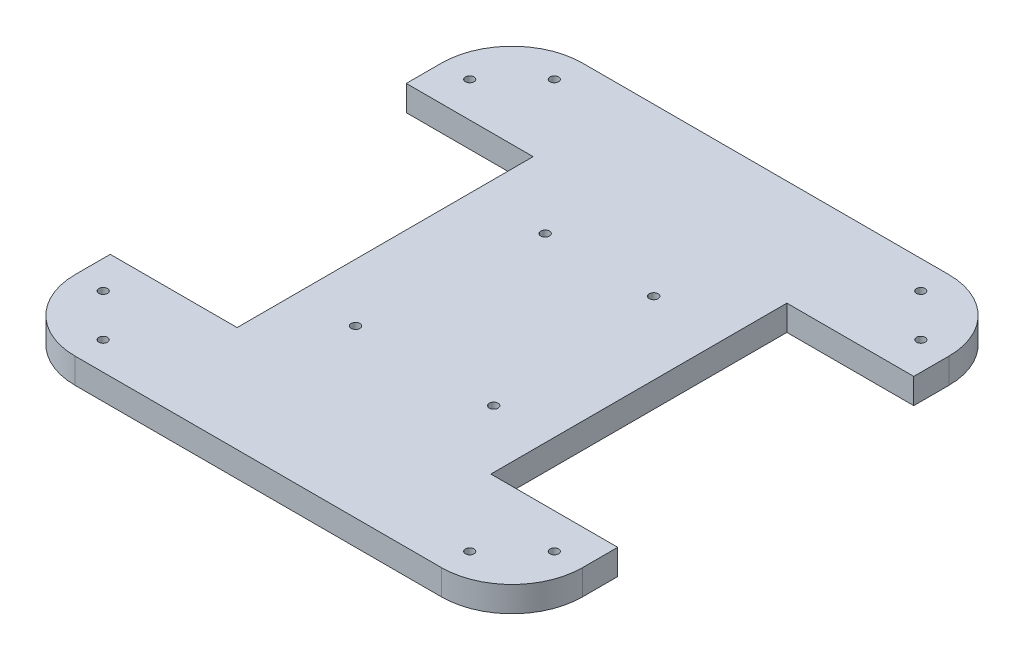
from build123d import *

# Parameters (mm, degrees)
PLATE_DEPTH         = 9
SKETCH3_R           = 1.525
HEX_HOLES_DEPTH     = 128.597021909
SKETCH4_R           = 1.55
ARDUINO_HOLES_DEPTH = 128.597021909
SKETCH5_W           = 45
SKETCH5_H           = 105
CUT_EXTRUDE1_DEPTH  = 128.597021909


with BuildPart() as part:
    # Sketch1 → Plate (new body)
    with BuildSketch(Plane(origin=(0, 0, 0), x_dir=(1, 0, 0), z_dir=(0, 1, 0))):
        with BuildLine():
            Line((-65, -90), (65, -90))
            ThreePointArc((65, -90), (82.67766953, -82.67766953), (90, -65))
            Line((90, -65), (90, 65))
            ThreePointArc((90, 65), (82.67766953, 82.67766953), (65, 90))
            Line((65, 90), (-65, 90))
            ThreePointArc((-65, 90), (-82.67766953, 82.67766953), (-90, 65))
            Line((-90, 65), (-90, -65))
            ThreePointArc((-90, -65), (-82.67766953, -82.67766953), (-65, -90))
        make_face()
    extrude(amount=PLATE_DEPTH)

    # Sketch3 → Hex Holes (cut, through all)
    with BuildSketch(Plane(origin=(0, 9, 0), x_dir=(1, 0, 0), z_dir=(0, 1, 0))):
        with Locations((-65, 80)):
            Circle(SKETCH3_R)
        with Locations((-80, 65)):
            Circle(SKETCH3_R)
        with Locations((80, 65)):
            Circle(SKETCH3_R)
        with Locations((80, -65)):
            Circle(SKETCH3_R)
        with Locations((65, 80)):
            Circle(SKETCH3_R)
        with Locations((65, -80)):
            Circle(SKETCH3_R)
        with Locations((-65, -80)):
            Circle(SKETCH3_R)
        with Locations((-80, -65)):
            Circle(SKETCH3_R)
    extrude(amount=-HEX_HOLES_DEPTH, mode=Mode.SUBTRACT)

    # Sketch4 → Arduino Holes (cut, through all)
    with BuildSketch(Plane(origin=(0, 9, 0), x_dir=(1, 0, 0), z_dir=(0, 1, 0))):
        with Locations((-24.5, -31)):
            Circle(SKETCH4_R)
        with Locations((24.5, -31)):
            Circle(SKETCH4_R)
        with Locations((-19.25, 31)):
            Circle(SKETCH4_R)
        with Locations((19.25, 31)):
            Circle(SKETCH4_R)
    extrude(amount=-ARDUINO_HOLES_DEPTH, mode=Mode.SUBTRACT)

    # Sketch5 → Cut-Extrude1 (cut, through all)
    with BuildSketch(Plane(origin=(0, 9, 0), x_dir=(1, 0, 0), z_dir=(0, 1, 0))):
        with Locations((-67.5, 0)):
            Rectangle(SKETCH5_W, SKETCH5_H)
        with Locations((67.5, 0)):
            Rectangle(SKETCH5_W, SKETCH5_H)
    extrude(amount=-CUT_EXTRUDE1_DEPTH, mode=Mode.SUBTRACT)


solid = part.part
